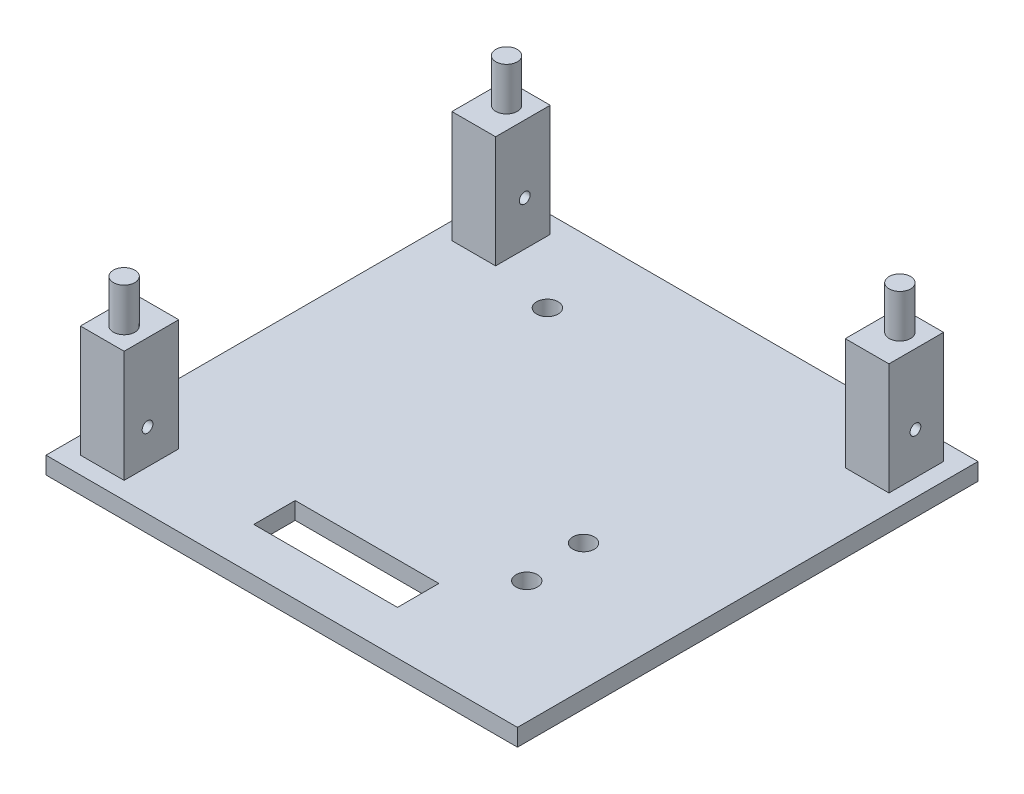
from build123d import *

# Parameters (mm, degrees)
SKETCH2_W           = 54.8
SKETCH2_H           = 53.53
BOSS_EXTRUDE1_DEPTH = 2
SKETCH3_W           = 5.08
SKETCH3_H           = 6.35
BOSS_EXTRUDE2_DEPTH = 13
SKETCH6_R           = 1.25
BOSS_EXTRUDE3_DEPTH = 5
CUT_EXTRUDE1_REACH  = 45.21
SKETCH7_W           = 16.699177442
SKETCH7_H           = 4.814543076
CUT_EXTRUDE2_REACH  = 45.21
SKETCH8_R           = 1.25
CUT_EXTRUDE4_REACH  = 64.484
SKETCH9_R           = 0.625
CUT_EXTRUDE5_REACH  = 64.484
SKETCH10_R          = 0.625
CUT_EXTRUDE6_REACH  = 64.484
SKETCH11_R          = 0.625
CUT_EXTRUDE7_REACH  = 44.322
SKETCH12_R          = 1.25


with BuildPart() as part:
    # Sketch2 → Boss-Extrude1 (new body)
    with BuildSketch(Plane(origin=(0, 0, 0), x_dir=(1, 0, 0), z_dir=(0, 1, 0))):
        Rectangle(SKETCH2_W, SKETCH2_H)
    extrude(amount=BOSS_EXTRUDE1_DEPTH)

    # Sketch3 → Boss-Extrude2 (add)
    with BuildSketch(Plane(origin=(0, 2, 0), x_dir=(1, 0, 0), z_dir=(0, 1, 0))):
        with Locations((-22.86, 21.59)):
            Rectangle(SKETCH3_W, SKETCH3_H)
        with Locations((22.86, 21.59)):
            Rectangle(SKETCH3_W, SKETCH3_H)
        with Locations((-22.86, -21.59)):
            Rectangle(SKETCH3_W, SKETCH3_H)
    extrude(amount=BOSS_EXTRUDE2_DEPTH)

    # Sketch6 → Boss-Extrude3 (add)
    with BuildSketch(Plane(origin=(0, 15, 0), x_dir=(1, 0, 0), z_dir=(0, 1, 0))):
        with Locations((-22.86, 22.225)):
            Circle(SKETCH6_R)
        with Locations((22.86, 22.225)):
            Circle(SKETCH6_R)
        with Locations((-22.86, -22.225)):
            Circle(SKETCH6_R)
    extrude(amount=BOSS_EXTRUDE3_DEPTH)

    # Sketch7 → Cut-Extrude1 (cut, up to next)
    with BuildSketch(Plane(origin=(0, 0, 0), x_dir=(-1, 0, 0), z_dir=(0, -1, 0)), mode=Mode.PRIVATE) as cut_extrude1_sk1:
        with Locations((0, -19.255020127)):
            Rectangle(SKETCH7_W, SKETCH7_H)
    cut_extrude1_tool1 = extrude(cut_extrude1_sk1.sketch, amount=-CUT_EXTRUDE1_REACH, mode=Mode.PRIVATE) & part.part
    add(cut_extrude1_tool1.solids().sort_by_distance((0, 0, 19.25502))[0], mode=Mode.SUBTRACT)

    # Sketch8 → Cut-Extrude2 (cut, up to next)
    with BuildSketch(Plane.XZ, mode=Mode.PRIVATE) as cut_extrude2_sk1:
        with Locations((12.687406074, 4.371050227)):
            Circle(SKETCH8_R)
    cut_extrude2_tool1 = extrude(cut_extrude2_sk1.sketch, amount=-CUT_EXTRUDE2_REACH, mode=Mode.PRIVATE) & part.part
    # Sketch8 → Cut-Extrude2 (cut, up to next)
    with BuildSketch(Plane.XZ, mode=Mode.PRIVATE) as cut_extrude2_sk2:
        with Locations((-13.082668869, -17.197391373)):
            Circle(SKETCH8_R)
    cut_extrude2_tool2 = extrude(cut_extrude2_sk2.sketch, amount=-CUT_EXTRUDE2_REACH, mode=Mode.PRIVATE) & part.part
    add(cut_extrude2_tool1.solids().sort_by_distance((12.687406, 0, 4.37105))[0], mode=Mode.SUBTRACT)
    add(cut_extrude2_tool2.solids().sort_by_distance((-13.082669, 0, -17.197391))[0], mode=Mode.SUBTRACT)

    # Sketch9 → Cut-Extrude4 (cut, up to next)
    with BuildSketch(Plane.ZY.offset(25.4), mode=Mode.PRIVATE) as cut_extrude4_sk1:
        with Locations((-21.804497524, 7.157449877)):
            Circle(SKETCH9_R)
    cut_extrude4_tool1 = extrude(cut_extrude4_sk1.sketch, amount=-CUT_EXTRUDE4_REACH, mode=Mode.PRIVATE) & part.part
    add(cut_extrude4_tool1.solids().sort_by_distance((-25.4, 7.15745, -21.804498))[0], mode=Mode.SUBTRACT)

    # Sketch10 → Cut-Extrude5 (cut, up to next)
    with BuildSketch(Plane(origin=(25.4, 0, 0), x_dir=(0, 0, -1), z_dir=(1, 0, 0)), mode=Mode.PRIVATE) as cut_extrude5_sk1:
        with Locations((21.493617153, 6.854012901)):
            Circle(SKETCH10_R)
    cut_extrude5_tool1 = extrude(cut_extrude5_sk1.sketch, amount=-CUT_EXTRUDE5_REACH, mode=Mode.PRIVATE) & part.part
    add(cut_extrude5_tool1.solids().sort_by_distance((25.4, 6.854013, -21.493617))[0], mode=Mode.SUBTRACT)

    # Sketch11 → Cut-Extrude6 (cut, up to next)
    with BuildSketch(Plane.ZY.offset(25.4), mode=Mode.PRIVATE) as cut_extrude6_sk1:
        with Locations((22.045503356, 6.022730906)):
            Circle(SKETCH11_R)
    cut_extrude6_tool1 = extrude(cut_extrude6_sk1.sketch, amount=-CUT_EXTRUDE6_REACH, mode=Mode.PRIVATE) & part.part
    add(cut_extrude6_tool1.solids().sort_by_distance((-25.4, 6.022731, 22.045503))[0], mode=Mode.SUBTRACT)

    # Sketch12 → Cut-Extrude7 (cut, up to next)
    with BuildSketch(Plane(origin=(0, 2, 0), x_dir=(1, 0, 0), z_dir=(0, 1, 0)), mode=Mode.PRIVATE) as cut_extrude7_sk1:
        with Locations((13.190585134, -11.475344034)):
            Circle(SKETCH12_R)
    cut_extrude7_tool1 = extrude(cut_extrude7_sk1.sketch, amount=-CUT_EXTRUDE7_REACH, mode=Mode.PRIVATE) & part.part
    add(cut_extrude7_tool1.solids().sort_by_distance((13.190585, 2, 11.475344))[0], mode=Mode.SUBTRACT)


solid = part.part
